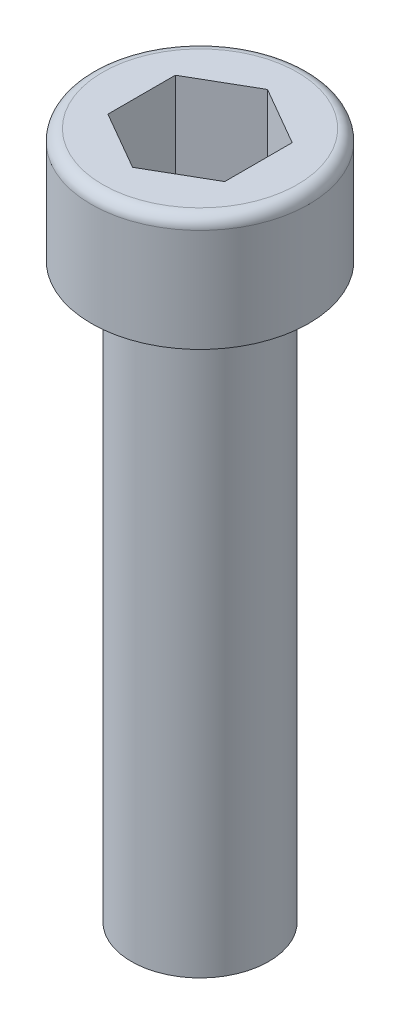
from build123d import *

# Parameters (mm, degrees)
SKETCH1_R           = 4.75
BOSS_EXTRUDE1_DEPTH = 5
SKETCH2_R           = 3
BOSS_EXTRUDE2_DEPTH = 25
FILLET1_R           = 0.5
CUT_EXTRUDE1_DEPTH  = 4


with BuildPart() as part:
    # Sketch1 → Boss-Extrude1 (new body)
    with BuildSketch(Plane(origin=(0, 0, 0), x_dir=(1, 0, 0), z_dir=(0, 1, 0))):
        Circle(SKETCH1_R)
    extrude(amount=BOSS_EXTRUDE1_DEPTH)

    # Sketch2 → Boss-Extrude2 (add)
    with BuildSketch(Plane.XZ):
        Circle(SKETCH2_R)
    extrude(amount=BOSS_EXTRUDE2_DEPTH)

    # Fillet1
    fillet1_edges = [part.edges().sort_by_distance(p)[0] for p in [
        (-4.75, 5, 0),
    ]]
    fillet(fillet1_edges, radius=FILLET1_R)

    # Sketch3 → Cut-Extrude1 (cut)
    with BuildSketch(Plane(origin=(0, 5, 0), x_dir=(1, 0, 0), z_dir=(0, 1, 0))):
        Polygon((0, 2.944486373), (-2.55, 1.472243186), (-2.55, -1.472243186), (0, -2.944486373), (2.55, -1.472243186), (2.55, 1.472243186), align=None)
    extrude(amount=-CUT_EXTRUDE1_DEPTH, mode=Mode.SUBTRACT)


solid = part.part
